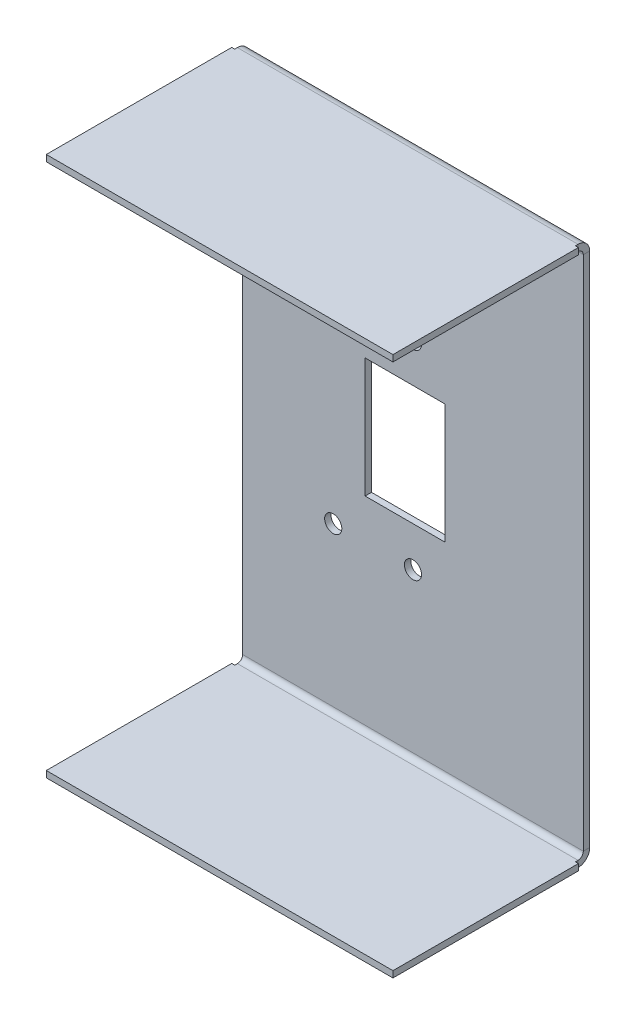
from build123d import *

# Parameters (mm, degrees)
SKETCH1_R                    = 2.15265
SKETCH1_W                    = 20
SKETCH1_H                    = 30
BASE_FLANGE1_DEPTH           = 1.6002
SKETCHED_BEND1_OUTLINE_W     = 86.92285
SKETCHED_BEND1_OUTLINE_H     = 1.6002
SKETCHED_BEND1_DEPTH         = 180.344310973
SKETCHED_START               = 183.63
SKETCHED_BEND1_2_OUTLINE_W   = 86.92285
SKETCHED_BEND1_2_OUTLINE_H   = 1.6002
SKETCHED_BEND1_2_DEPTH       = 46.5
SKETCHED_START_2             = 181.496703893
SKETCHED_BEND1_3_OUTLINE_W   = 85.42285
SKETCHED_BEND1_3_OUTLINE_H   = 132.181185133
SKETCHED_BEND1_3_OUTLINE_R   = 2.15265
SKETCHED_BEND1_3_OUTLINE_W_2 = 20
SKETCHED_BEND1_3_OUTLINE_H_2 = 30
SKETCHED_BEND1_3_DEPTH       = 0.14770354
SKETCHED_START_3             = 182.965207433
SKETCHED_BEND1_4_OUTLINE_W   = 85.42285
SKETCHED_BEND1_4_OUTLINE_H   = 1.6002
SKETCHED_BEND1_4_DEPTH       = 0.664792567
SKETCHED_START_4             = 180.044207433
SKETCHED_BEND1_5_OUTLINE_W   = 85.42285
SKETCHED_BEND1_5_OUTLINE_H   = 132.181185133
SKETCHED_BEND1_5_OUTLINE_R   = 2.15265
SKETCHED_BEND1_5_OUTLINE_W_2 = 20
SKETCHED_BEND1_5_OUTLINE_H_2 = 30
SKETCHED_BEND1_5_DEPTH       = 2.921
SKETCHED_START_5             = 0.75
SKETCHED_BEND1_6_DEPTH       = 85.42285
SKETCHED_START_6             = 132.181185133
SKETCHED_BEND1_7_DEPTH       = 1.6002
SKETCHED_BEND1_8_DEPTH       = 85.42285


with BuildPart() as part:
    # Base-Flange1: sheet metal written as solids
    # Sketch1 → Base-Flange1 (new body)
    with BuildSketch(Plane(origin=(0, 0, 0), x_dir=(1, 0, 0), z_dir=(0, 1, 0))):
        with BuildLine():
            Line((0.75, -46.6), (0.75, -183.53))
            ThreePointArc((0.75, -183.53), (0.720710678, -183.600710678), (0.65, -183.63))
            Line((0.65, -183.63), (0, -183.63))
            Line((0, -183.63), (0, -230.13))
            Line((0, -230.13), (86.92285, -230.13))
            Line((86.92285, -230.13), (86.92285, -183.63))
            Line((86.92285, -183.63), (86.27285, -183.63))
            ThreePointArc((86.27285, -183.63), (86.202139322, -183.600710678), (86.17285, -183.53))
            Line((86.17285, -183.53), (86.17285, -46.6))
            ThreePointArc((86.17285, -46.6), (86.202139322, -46.529289322), (86.27285, -46.5))
            Line((86.27285, -46.5), (86.92285, -46.5))
            Line((86.92285, -46.5), (86.92285, 0))
            Line((86.92285, 0), (0, 0))
            Line((0, 0), (0, -46.5))
            Line((0, -46.5), (0.65, -46.5))
            ThreePointArc((0.65, -46.5), (0.720710678, -46.529289322), (0.75, -46.6))
        make_face()
        with Locations(Location((43.461425, -90.065, 0), (0, 0, 270))):
            Circle(SKETCH1_R, mode=Mode.SUBTRACT)
        with Locations(Location((43.461425, -140.065, 0), (0, 0, 270))):
            Circle(SKETCH1_R, mode=Mode.SUBTRACT)
        with Locations(Location((23.461425, -90.065, 0), (0, 0, 270))):
            Circle(SKETCH1_R, mode=Mode.SUBTRACT)
        with Locations(Location((23.461425, -140.065, 0), (0, 0, 270))):
            Circle(SKETCH1_R, mode=Mode.SUBTRACT)
        with Locations((41.461425, -115.065)):
            Rectangle(SKETCH1_W, SKETCH1_H, mode=Mode.SUBTRACT)
    extrude(amount=-BASE_FLANGE1_DEPTH)

    # Sketched Bend1: read off the stored shape, not the designer's step
    # Sketched Bend1 outline → Sketched Bend1 (cut)
    with BuildSketch(Plane.XY):
        with Locations((43.461425, -0.8001)):
            Rectangle(SKETCHED_BEND1_OUTLINE_W, SKETCHED_BEND1_OUTLINE_H)
    extrude(amount=SKETCHED_BEND1_DEPTH, mode=Mode.SUBTRACT)

    # Sketched Bend1 3 outline → Sketched Bend1 3 (add)
    with BuildSketch(Plane.XY.offset(SKETCHED_START_2)):
        with Locations((43.461425, 66.090592567)):
            Rectangle(SKETCHED_BEND1_3_OUTLINE_W, SKETCHED_BEND1_3_OUTLINE_H)
        with Locations((23.461425, 41.090592567)):
            Circle(SKETCHED_BEND1_3_OUTLINE_R, mode=Mode.SUBTRACT)
        with Locations((43.461425, 41.090592567)):
            Circle(SKETCHED_BEND1_3_OUTLINE_R, mode=Mode.SUBTRACT)
        with Locations((41.461425, 66.090592567)):
            Rectangle(SKETCHED_BEND1_3_OUTLINE_W_2, SKETCHED_BEND1_3_OUTLINE_H_2, mode=Mode.SUBTRACT)
        with Locations((23.461425, 91.090592567)):
            Circle(SKETCHED_BEND1_3_OUTLINE_R, mode=Mode.SUBTRACT)
        with Locations((43.461425, 91.090592567)):
            Circle(SKETCHED_BEND1_3_OUTLINE_R, mode=Mode.SUBTRACT)
    extrude(amount=SKETCHED_BEND1_3_DEPTH)



with BuildPart() as body_2:
    # Sketched Bend1 2 outline → Sketched Bend1 2 (new body)
    with BuildSketch(Plane.XY.offset(SKETCHED_START)):
        with Locations((43.461425, 132.981285133)):
            Rectangle(SKETCHED_BEND1_2_OUTLINE_W, SKETCHED_BEND1_2_OUTLINE_H)
    extrude(amount=SKETCHED_BEND1_2_DEPTH)

    # Sketched Bend1 4 outline → Sketched Bend1 4 (add)
    with BuildSketch(Plane.XY.offset(SKETCHED_START_3)):
        with Locations((43.461425, 132.981285133)):
            Rectangle(SKETCHED_BEND1_4_OUTLINE_W, SKETCHED_BEND1_4_OUTLINE_H)
    extrude(amount=SKETCHED_BEND1_4_DEPTH)


with BuildPart() as part_1:
    add(part.part)

    add(body_2.part)  # Sketched Bend1 5 merges body 2
    # Sketched Bend1 5 outline → Sketched Bend1 5 (add)
    with BuildSketch(Plane.XY.offset(SKETCHED_START_4)):
        with Locations((43.461425, 66.090592567)):
            Rectangle(SKETCHED_BEND1_5_OUTLINE_W, SKETCHED_BEND1_5_OUTLINE_H)
        with Locations((23.461425, 41.090592567)):
            Circle(SKETCHED_BEND1_5_OUTLINE_R, mode=Mode.SUBTRACT)
        with Locations((43.461425, 41.090592567)):
            Circle(SKETCHED_BEND1_5_OUTLINE_R, mode=Mode.SUBTRACT)
        with Locations((41.461425, 66.090592567)):
            Rectangle(SKETCHED_BEND1_5_OUTLINE_W_2, SKETCHED_BEND1_5_OUTLINE_H_2, mode=Mode.SUBTRACT)
        with Locations((23.461425, 91.090592567)):
            Circle(SKETCHED_BEND1_5_OUTLINE_R, mode=Mode.SUBTRACT)
        with Locations((43.461425, 91.090592567)):
            Circle(SKETCHED_BEND1_5_OUTLINE_R, mode=Mode.SUBTRACT)
    extrude(amount=SKETCHED_BEND1_5_DEPTH)

    # Sketched Bend1 6 outline → Sketched Bend1 6 (add)
    with BuildSketch(Plane.YZ.offset(SKETCHED_START_5)):
        with BuildLine():
            Line((133.781385133, 182.965207433), (132.181185133, 182.965207433))
            Line((132.181185133, 182.965207433), (132.181185133, 180.359880513))
            ThreePointArc((132.181185133, 180.359880513), (133.349390737, 181.436452352), (133.781385133, 182.965207433))
        make_face()
    extrude(amount=SKETCHED_BEND1_6_DEPTH)

    # Sketched Bend1 7 outline → Sketched Bend1 7 (add)
    with BuildSketch(Plane(origin=(0, 0, 0), x_dir=(1, 0, 0), z_dir=(0, 1, 0)).offset(SKETCHED_START_6)):
        with BuildLine():
            Line((0.75, -183.63), (0.75, -183.53))
            ThreePointArc((0.75, -183.53), (0.720710678, -183.600710678), (0.65, -183.63))
            Line((0.65, -183.63), (0.75, -183.63))
        make_face()
        with BuildLine():
            ThreePointArc((86.27285, -183.63), (86.202139322, -183.600710678), (86.17285, -183.53))
            Line((86.17285, -183.53), (86.17285, -183.63))
            Line((86.17285, -183.63), (86.27285, -183.63))
        make_face()
    extrude(amount=SKETCHED_BEND1_7_DEPTH)

    # Sketched Bend1 8 outline → Sketched Bend1 8 (cut)
    with BuildSketch(Plane.YZ.offset(SKETCHED_START_5)):
        with BuildLine():
            ThreePointArc((130.860385133, 181.644407433), (131.79433177, 182.031260796), (132.181185133, 182.965207433))
            Line((132.181185133, 182.965207433), (0, 182.965207433))
            ThreePointArc((0, 182.965207433), (0.386853363, 182.031260796), (1.3208, 181.644407433))
            Line((1.3208, 181.644407433), (130.860385133, 181.644407433))
        make_face()
        with BuildLine():
            Line((132.181185133, 180.044207433), (132.181185133, 180.359880513))
            ThreePointArc((132.181185133, 180.359880513), (131.539384789, 180.124221607), (130.860385133, 180.044207433))
            Line((130.860385133, 180.044207433), (132.181185133, 180.044207433))
        make_face()
        with BuildLine():
            Line((0, 180.04420738), (1.3208, 180.044207433))
            ThreePointArc((1.3208, 180.044207433), (-0.744658907, 180.899748526), (-1.6002, 182.965207433))
            Line((-1.6002, 182.965207433), (-1.600200001, 185))
            Line((-1.600200001, 185), (-3, 185))
            Line((-3, 185), (-3, 180.344310973))
            Line((-3, 180.344310973), (0, 180.344310973))
            Line((0, 180.344310973), (0, 180.04420738))
        make_face()
    extrude(amount=SKETCHED_BEND1_8_DEPTH, mode=Mode.SUBTRACT)


solid = part_1.part
